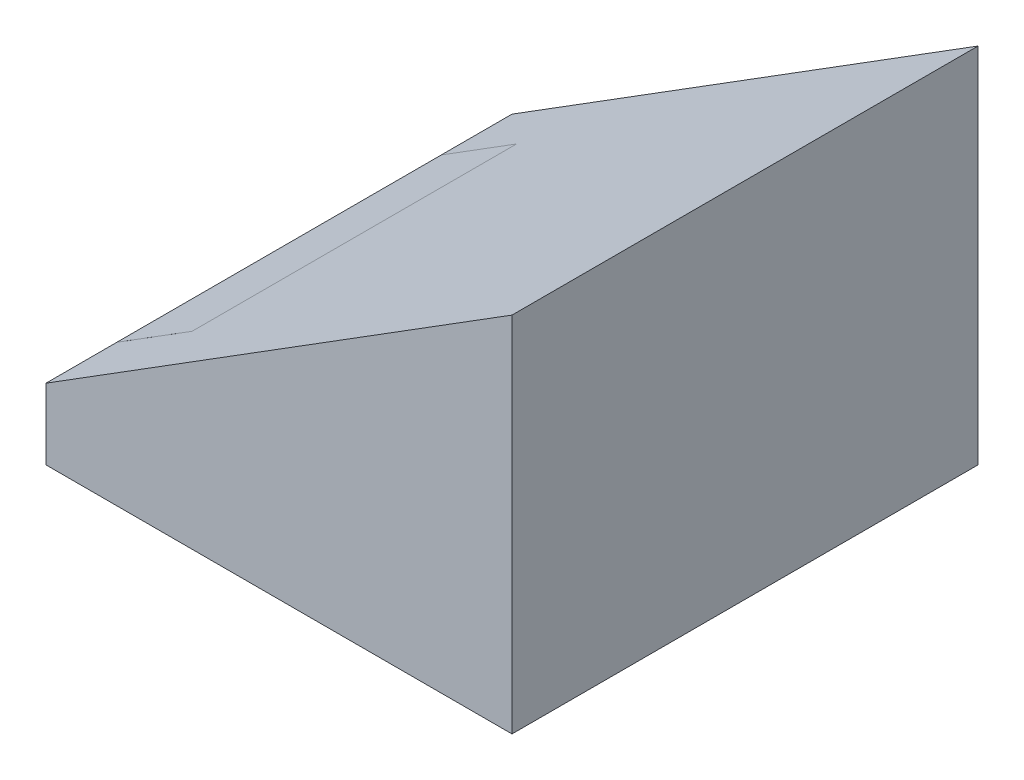
from build123d import *

# Parameters (mm, degrees)
MAINBASESKETCH_W          = 15.8
MAINBASESKETCH_H          = 3.2
MAINBASEEXTRUDE_DEPTH     = 7.9
STUDSSKETCH_R             = 2.4
STUDSEXTRUDE_DEPTH        = 1.6
MAINBASESHELL_T           = -1.2
LCUTBLUE_DEPTH            = 19.555463972
LCUTBLUE_DEPTH_BACK       = 19.555463972
CUTADDEDTOLCUT_DEPTH      = 2
MADESLIMCUTSKETCH_W       = 7.9
MADESLIMCUTSKETCH_H       = 7.9
MADESLIMCUT_DEPTH         = 19.897228453
MADESLIMFILLEXT_REACH     = 20.555
SKETCH33_W                = 5.500952983
SKETCH33_H                = 1.199047018
ANGLEDSLIMBASECUT_DEPTH   = 19.555463972
ANGLEDSLIMBASESWEEP_DEPTH = 7.9
CUT_EXTRUDE24_DEPTH       = 20.284391181
BOSS_EXTRUDE17_START      = 0.0001
BOSS_EXTRUDE17_DEPTH      = 5.5


# Read off the part's stored shape, not the designer's step: AngledSlimBaseSweep
with BuildPart() as part:
    # MainBaseSketch → MainBaseExtrude (new, symmetric)
    with BuildSketch(Plane.XY):
        with Locations((8.581967213, 1.6)):
            Rectangle(MAINBASESKETCH_W, MAINBASESKETCH_H)
    extrude(amount=MAINBASEEXTRUDE_DEPTH, both=True)

    # StudsSketch → StudsExtrude (add)
    with BuildSketch(Plane(origin=(0, 3.2, 0), x_dir=(1, 0, 0), z_dir=(0, 1, 0))):
        with Locations((4.581967213, 4)):
            Circle(STUDSSKETCH_R)
    extrude(amount=STUDSEXTRUDE_DEPTH)

    # MainBaseShell
    mainbaseshell_openings = [part.faces().sort_by_distance(p)[0] for p in [
        (8.581967213, 0, 0),
    ]]
    offset(amount=MAINBASESHELL_T, openings=mainbaseshell_openings, kind=Kind.INTERSECTION)

    # LCUTBlueSketch → LCutBlue (cut, two sides: drawn at the far end of the back side and taken through both)
    with BuildSketch(Plane(origin=(0, 3.2, 0), x_dir=(1, 0, 0), z_dir=(0, 1, 0)).offset(-LCUTBLUE_DEPTH_BACK)):
        Polygon((8.581967213, 53.229874044), (8.581967213, 7.9), (8.581967213, 0), (16.481967213, 0), (61.811841258, 0), (125.917963912, 64.106122654), (72.688089868, 117.335996699), align=None)
    extrude(amount=LCUTBLUE_DEPTH + LCUTBLUE_DEPTH_BACK, mode=Mode.SUBTRACT)

    # CutAddedtoLSketch → CutAddedToLCut (add)
    with BuildSketch(Plane.XZ):
        Polygon((7.382920196, -6.7), (8.581967213, -6.7), (8.581967213, 0), (15.281967213, 0), (15.281967213, 1.199047018), (7.382920196, 1.199047018), (7.382920196, 0), align=None)
    extrude(amount=-CUTADDEDTOLCUT_DEPTH)

    # MadeSlimCutSketch → MadeSlimCut (cut, through all)
    with BuildSketch(Plane.XZ):
        with Locations((4.631967213, -3.95)):
            Rectangle(MADESLIMCUTSKETCH_W, MADESLIMCUTSKETCH_H)
    extrude(amount=-MADESLIMCUT_DEPTH, mode=Mode.SUBTRACT)

    # Sketch33 → MadeSlimFillExt (add, up to next)
    with BuildSketch(Plane.XZ, mode=Mode.PRIVATE) as madeslimfillext_sk1:
        with Locations((4.632443704, 0.599523509)):
            Rectangle(SKETCH33_W, SKETCH33_H)
    madeslimfillext_tool1 = extrude(madeslimfillext_sk1.sketch, amount=-MADESLIMFILLEXT_REACH, mode=Mode.PRIVATE) - part.part
    add(madeslimfillext_tool1.solids().sort_by_distance((4.632444, 0, 0.599524))[0])

    # AngledSlimBaseSketch → AngledSlimBaseCut (cut, through all)
    with BuildSketch(Plane.XY.offset(7.9)):
        Polygon((16.481967213, 6.15), (0.681967213, 2.247699421), (16.481967213, 2.247699421), align=None)
    extrude(amount=-ANGLEDSLIMBASECUT_DEPTH, mode=Mode.SUBTRACT)


with BuildPart() as body_2:
    # of the pieces the cut leaves, the one that is kept (angledslimbasecut_keep)
    add(part.part.solids().sort_by_distance((0.681967213, 0, 7.9))[0])

    # AngledSlimBaseSweep outline → AngledSlimBaseSweep (add)
    with BuildSketch(Plane.XY):
        Polygon((16.481967213, 2.247699421), (16.481967213, 6.15), (0.681967213, 2.247699421), align=None)
    extrude(amount=ANGLEDSLIMBASESWEEP_DEPTH)

    # Sketch89 → Cut-Extrude24 (cut, through all)
    with BuildSketch(Plane.XY.offset(7.9)):
        Polygon((8.581967213, 0), (8.581967213, 1.200372495), (16.481967213, 6.15), (0.681967213, 2.247699421), (0.681967213, 0), align=None)
    extrude(amount=-CUT_EXTRUDE24_DEPTH, mode=Mode.SUBTRACT)


with BuildPart() as body_2_2:
    # Sketch93 → Boss-Extrude17 (new body)
    with BuildSketch(Plane.XY.offset(1.199047018).offset(BOSS_EXTRUDE17_START)):
        Polygon((8.581967213, 1.200372495), (9.858236444, 2), (9.858236444, 0), (8.581967213, 0), align=None)
    extrude(amount=BOSS_EXTRUDE17_DEPTH)


solid = Compound([body_2.part, body_2_2.part])
